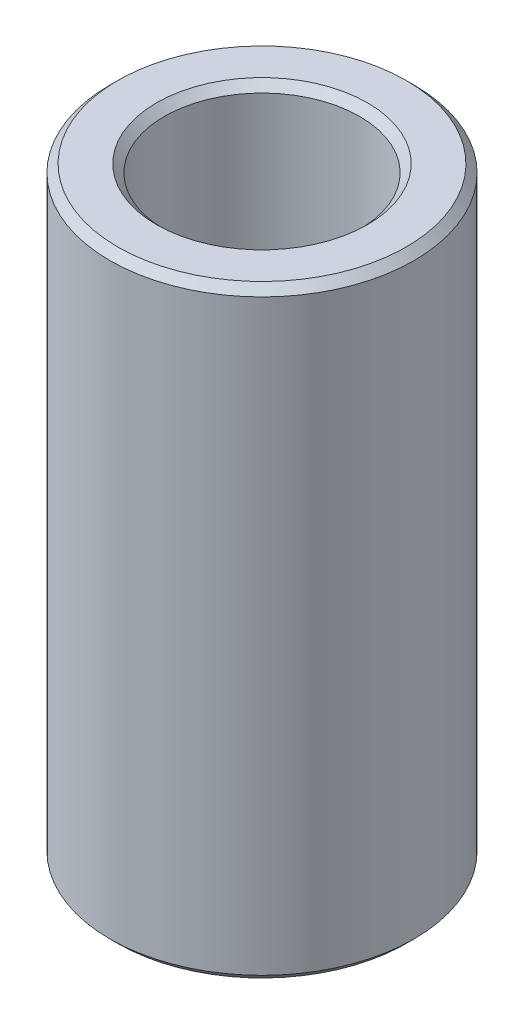
from build123d import *

# Parameters (mm, degrees)
SKETCH1_R           = 50
BOSS_EXTRUDE1_DEPTH = 198.325745107
SKETCH2_R           = 32.116252093
CUT_EXTRUDE1_DEPTH  = 211.554271323
CHAMFER1_SIZE       = 2.581086886


with BuildPart() as part:
    # Sketch1 → Boss-Extrude1 (new body)
    with BuildSketch(Plane(origin=(0, 0, 0), x_dir=(1, 0, 0), z_dir=(0, 1, 0))):
        Circle(SKETCH1_R)
    extrude(amount=BOSS_EXTRUDE1_DEPTH)

    # Sketch2 → Cut-Extrude1 (cut, through all)
    with BuildSketch(Plane(origin=(0, 0, 0), x_dir=(1, 0, 0), z_dir=(0, 1, 0))):
        Circle(SKETCH2_R)
    extrude(amount=CUT_EXTRUDE1_DEPTH, mode=Mode.SUBTRACT)

    # Chamfer1
    chamfer1_edges = [part.edges().sort_by_distance(p)[0] for p in [
        (-32.116252093, 198.325745107, 0),
        (-32.116252093, 0, 0),
        (-50, 0, 0),
        (-50, 198.325745107, 0),
    ]]
    chamfer(chamfer1_edges, length=CHAMFER1_SIZE)


solid = part.part
